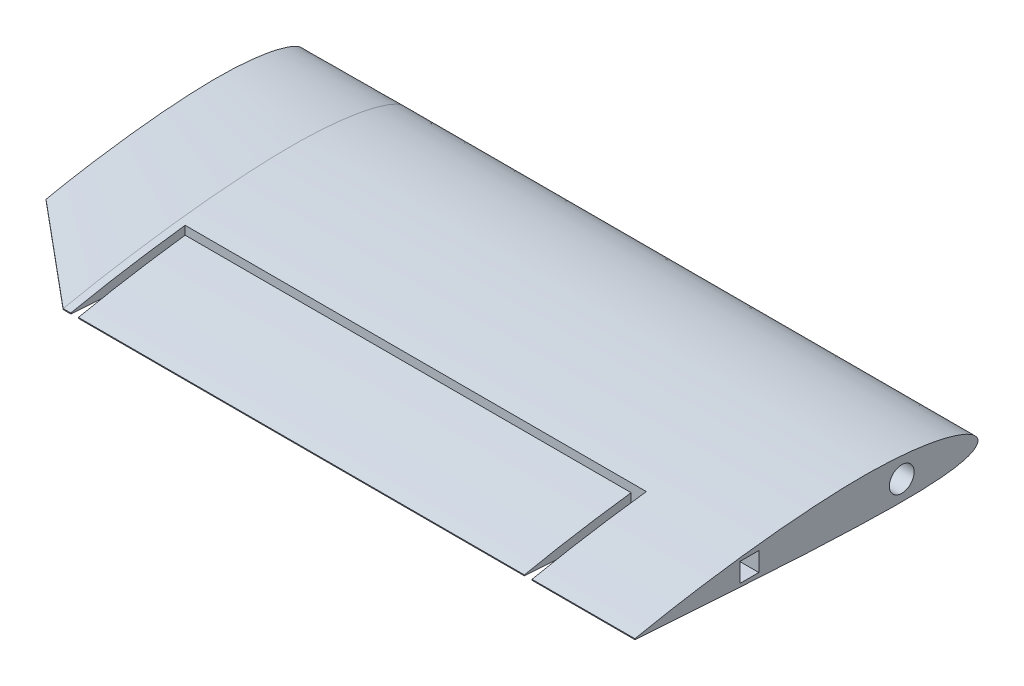
from build123d import *

# Parameters (mm, degrees)
EXTERIOR_DEPTH      = 90
BOSS_EXTRUDE1_DEPTH = 15
CUT_EXTRUDE1_DEPTH  = 187.882316063
BOSS_EXTRUDE2_DEPTH = 270
CUT_EXTRUDE3_DEPTH  = 3
SKETCH15_R          = 1.749999997
CUT_EXTRUDE4_DEPTH  = 4
CUT_EXTRUDE5_DEPTH  = 2.5
CUT_EXTRUDE6_DEPTH  = 287.184732781
BOSS_EXTRUDE3_DEPTH = 25
SKETCH20_R          = 3.25
CUT_EXTRUDE7_DEPTH  = 80
CUT_EXTRUDE8_DEPTH  = 195.44544138
CUT_EXTRUDE9_DEPTH  = 413.932233564
SKETCH26_W          = 35
SKETCH26_H          = 35
CUT_EXTRUDE11_DEPTH = 24
SKETCH27_R          = 3.25
BOSS_EXTRUDE4_DEPTH = 25
SKETCH29_W          = 5
SKETCH29_H          = 5
CUT_EXTRUDE12_DEPTH = 10


with BuildPart() as part:
    # Sketch4 → Exterior (new body)
    with BuildSketch(Plane.XY):
        with BuildLine():
            Line((-30.310889132, 17.5), (30.310889132, 17.5))
            ThreePointArc((30.310889132, 17.5), (0, 35), (-30.310889132, 17.5))
        make_face()
    extrude(amount=EXTERIOR_DEPTH)

    # Sketch5 → Boss-Extrude1 (add)
    with BuildSketch(Plane(origin=(0, 0, 0), x_dir=(-1, 0, 0), z_dir=(0, 0, -1))):
        with BuildLine():
            Line((23.12466216, 17.5), (-23.12466216, 17.5))
            ThreePointArc((-23.12466216, 17.5), (0, 29), (23.12466216, 17.5))
        make_face()
    extrude(amount=BOSS_EXTRUDE1_DEPTH)

    # Sketch8 → Loft9 section 0
    with BuildSketch(Plane(origin=(80, 0, 0), x_dir=(0, 0, -1), z_dir=(1, 0, 0))):
        with BuildLine():
            Line((-90, 21.432366243), (-90, 21.198382159))
            add(Edge.make_bspline(
                [(-90, 21.432366243), (-88.500933926, 21.739545374), (-85.506738957, 22.353096852), (-79.513207025, 23.476900974), (-72.017254902, 24.722076868), (-63.016159498, 26.010803551), (-54.016548901, 27.085553985), (-45.013036623, 27.872502339), (-36.011574753, 28.405421098), (-28.501382509, 28.495628322), (-22.499148056, 28.247142418), (-17.99379134, 27.883038763), (-13.482746661, 27.306456938), (-9.728435841, 26.596441021), (-6.735425578, 25.793161808), (-4.466301103, 25.062862179), (-2.543789771, 24.211953422), (-0.885448876, 23.18032068), (0.560680661, 21.396258105), (-0.941462624, 19.828099306), (-2.568784612, 19.112875936), (-4.482837902, 18.569587924), (-6.74449179, 18.180048952), (-9.749480667, 17.847620831), (-13.500436316, 17.59175521), (-18.004367236, 17.489171146), (-22.5050837, 17.50346658), (-28.505231535, 17.63591039), (-36.00611648, 17.874235378), (-45.006065516, 18.288993082), (-54.003404842, 18.828075055), (-63.002270201, 19.388407607), (-72.00267421, 19.955585158), (-79.500543105, 20.477953196), (-85.500687681, 20.880865225), (-88.500160566, 21.092538335), (-90, 21.198382159)],
                knots=[0, 0, 0, 0, 0.02501249, 0.049959286, 0.099672925, 0.14920632, 0.198581097, 0.24780517, 0.296916575, 0.345952722, 0.370491626, 0.395091204, 0.419814796, 0.444798575, 0.457489819, 0.470406405, 0.483879409, 0.49126412, 0.503458853, 0.513609129, 0.520450991, 0.533235388, 0.545691039, 0.558031884, 0.582609167, 0.607134742, 0.63165208, 0.656174272, 0.705233949, 0.754320379, 0.803437364, 0.852566096, 0.901700994, 0.950848809, 0.975422717, 1, 1, 1, 1], degree=3))
        make_face()
    # Sketch9 → Loft9 section 1
    with BuildSketch(Plane(origin=(-80, 0, 0), x_dir=(0, 0, -1), z_dir=(1, 0, 0))):
        with BuildLine():
            Line((-90, 21.432366243), (-90, 21.198382159))
            add(Edge.make_bspline(
                [(-90, 21.432366243), (-88.500933926, 21.739545374), (-85.506738957, 22.353096852), (-79.513207025, 23.476900974), (-72.017254902, 24.722076868), (-63.016159498, 26.010803551), (-54.016548901, 27.085553985), (-45.013036623, 27.872502339), (-36.011574753, 28.405421098), (-28.501382509, 28.495628322), (-22.499148056, 28.247142418), (-17.99379134, 27.883038763), (-13.482746661, 27.306456938), (-9.728435841, 26.596441021), (-6.735425578, 25.793161808), (-4.466301103, 25.062862179), (-2.543789771, 24.211953422), (-0.885448876, 23.18032068), (0.560680661, 21.396258105), (-0.941462624, 19.828099306), (-2.568784612, 19.112875936), (-4.482837902, 18.569587924), (-6.74449179, 18.180048952), (-9.749480667, 17.847620831), (-13.500436316, 17.59175521), (-18.004367236, 17.489171146), (-22.5050837, 17.50346658), (-28.505231535, 17.63591039), (-36.00611648, 17.874235378), (-45.006065516, 18.288993082), (-54.003404842, 18.828075055), (-63.002270201, 19.388407607), (-72.00267421, 19.955585158), (-79.500543105, 20.477953196), (-85.500687681, 20.880865225), (-88.500160566, 21.092538335), (-90, 21.198382159)],
                knots=[0, 0, 0, 0, 0.02501249, 0.049959286, 0.099672925, 0.14920632, 0.198581097, 0.24780517, 0.296916575, 0.345952722, 0.370491626, 0.395091204, 0.419814796, 0.444798575, 0.457489819, 0.470406405, 0.483879409, 0.49126412, 0.503458853, 0.513609129, 0.520450991, 0.533235388, 0.545691039, 0.558031884, 0.582609167, 0.607134742, 0.63165208, 0.656174272, 0.705233949, 0.754320379, 0.803437364, 0.852566096, 0.901700994, 0.950848809, 0.975422717, 1, 1, 1, 1], degree=3))
        make_face()
    loft()

    # Sketch12 → Cut-Extrude1 (cut, through all)
    with BuildSketch(Plane(origin=(80, 0, 0), x_dir=(0, 0, -1), z_dir=(1, 0, 0))):
        with BuildLine():
            add(Edge.make_bspline(
                [(-90, 21.432366243), (-88.517970234, 21.737980939), (-85.557803137, 22.348407657), (-79.632256681, 23.467116444), (-72.221134443, 24.707701375), (-63.321647609, 25.993209562), (-54.423365173, 27.067117347), (-45.520869444, 27.856425887), (-37.923196081, 28.315745298), (-33.290343793, 28.425153226), (-31.628845216, 28.436220013)],
                knots=[0, 0, 0, 0, 0.02501249, 0.049959286, 0.099672925, 0.14920632, 0.198581097, 0.24780517, 0.296916575, 0.324376959, 0.324376959, 0.324376959, 0.324376959], degree=3))
            add(Edge.make_bspline(
                [(-90, 21.432366243), (-88.500933926, 21.739545374), (-85.506738957, 22.353096852), (-79.513207025, 23.476900974), (-72.017254902, 24.722076868), (-63.016159498, 26.010803551), (-54.016548901, 27.085553985), (-45.013036623, 27.872502339), (-37.550589404, 28.314305923), (-33.087456779, 28.421897917), (-31.628845216, 28.436220013)],
                knots=[0, 0, 0, 0, 0.02501249, 0.049959286, 0.099672925, 0.14920632, 0.198581097, 0.24780517, 0.296916575, 0.320756027, 0.320756027, 0.320756027, 0.320756027], degree=3))
        make_face()
        with BuildLine():
            Line((-97.240851338, 26.906548897), (-90, 21.432366243))
            add(Edge.make_bspline(
                [(-90, 21.432366243), (-88.517970234, 21.737980939), (-85.557803137, 22.348407657), (-79.632256681, 23.467116444), (-72.221134443, 24.707701375), (-63.321647609, 25.993209562), (-54.423365173, 27.067117347), (-45.520869444, 27.856425887), (-37.923196081, 28.315745298), (-33.290343793, 28.425153226), (-31.628845216, 28.436220013)],
                knots=[0, 0, 0, 0, 0.02501249, 0.049959286, 0.099672925, 0.14920632, 0.198581097, 0.24780517, 0.296916575, 0.324376959, 0.324376959, 0.324376959, 0.324376959], degree=3))
            Line((-31.628845216, 28.436220013), (-0.011306323, 30.013384743))
            Line((-0.011306323, 30.013384743), (6.418630162, 38.518437853))
            Line((6.418630162, 38.518437853), (-30.113825381, 44.023328414))
            Line((-30.113825381, 44.023328414), (-90.292288108, 42.772216923))
            Line((-90.292288108, 42.772216923), (-97.240851338, 26.906548897))
        make_face()
    extrude(amount=-CUT_EXTRUDE1_DEPTH, mode=Mode.SUBTRACT)

    # Sketch17 → Boss-Extrude2 (add)
    with BuildSketch(Plane.ZY.offset(80)):
        with BuildLine():
            Line((90, 21.432366243), (90, 21.198382159))
            add(Edge.make_bspline(
                [(90, 21.432366243), (88.500933926, 21.739545374), (85.506738957, 22.353096852), (79.513207025, 23.476900974), (72.017254902, 24.722076868), (63.016159498, 26.010803551), (54.016548901, 27.085553985), (45.013036623, 27.872502339), (36.011574753, 28.405421098), (28.501382509, 28.495628322), (22.499148056, 28.247142418), (17.99379134, 27.883038763), (13.482746661, 27.306456938), (9.728435841, 26.596441021), (6.735425578, 25.793161808), (4.466301103, 25.062862179), (2.543789771, 24.211953422), (0.885448876, 23.18032068), (-0.560680661, 21.396258105), (0.941462624, 19.828099306), (2.568784612, 19.112875936), (4.482837902, 18.569587924), (6.74449179, 18.180048952), (9.749480667, 17.847620831), (13.500436316, 17.59175521), (18.004367236, 17.489171146), (22.5050837, 17.50346658), (28.505231535, 17.63591039), (36.00611648, 17.874235378), (45.006065516, 18.288993082), (54.003404842, 18.828075055), (63.002270201, 19.388407607), (72.00267421, 19.955585158), (79.500543105, 20.477953196), (85.500687681, 20.880865225), (88.500160566, 21.092538335), (90, 21.198382159)],
                knots=[0, 0, 0, 0, 0.02501249, 0.049959286, 0.099672925, 0.14920632, 0.198581097, 0.24780517, 0.296916575, 0.345952722, 0.370491626, 0.395091204, 0.419814796, 0.444798575, 0.457489819, 0.470406405, 0.483879409, 0.49126412, 0.503458853, 0.513609129, 0.520450991, 0.533235388, 0.545691039, 0.558031884, 0.582609167, 0.607134742, 0.63165208, 0.656174272, 0.705233949, 0.754320379, 0.803437364, 0.852566096, 0.901700994, 0.950848809, 0.975422717, 1, 1, 1, 1], degree=3))
        make_face()
    extrude(amount=BOSS_EXTRUDE2_DEPTH)

    # Sketch14 → Cut-Extrude3 (cut)
    with BuildSketch(Plane(origin=(0, 30, 0), x_dir=(1, 0, 0), z_dir=(0, 1, 0))):
        with BuildLine():
            Line((-65, -33.999999003), (-95, -33.999999003))
            ThreePointArc((-95, -33.999999003), (-101, -39.999999003), (-95, -45.999999003))
            Line((-95, -45.999999003), (-65, -45.999999003))
            ThreePointArc((-65, -45.999999003), (-59, -39.999999003), (-65, -33.999999003))
        make_face()
    cut_extrude3 = extrude(amount=-CUT_EXTRUDE3_DEPTH, mode=Mode.SUBTRACT)

    # Sketch15 → Cut-Extrude4 (cut)
    with BuildSketch(Plane(origin=(0, 27, 0), x_dir=(1, 0, 0), z_dir=(0, 1, 0))):
        with Locations((-65, -39.999999003)):
            Circle(SKETCH15_R)
        with Locations((-95, -39.999999003)):
            Circle(SKETCH15_R)
    cut_extrude4 = extrude(amount=-CUT_EXTRUDE4_DEPTH, mode=Mode.SUBTRACT)

    # Sketch16 → Cut-Extrude5 (cut)
    with BuildSketch(Plane(origin=(0, 23.5, 0), x_dir=(1, 0, 0), z_dir=(0, 1, 0))):
        Polygon((-67.165063509, -43.749999003), (-62.834936491, -43.749999003), (-60.669872981, -39.999999003), (-62.834936491, -36.249999003), (-67.165063509, -36.249999003), (-69.330127019, -39.999999003), align=None)
        Polygon((-90.669872981, -39.999999003), (-92.834936491, -43.749999003), (-97.165063509, -43.749999003), (-99.330127019, -39.999999003), (-97.165063509, -36.249999003), (-92.834936491, -36.249999003), align=None)
    cut_extrude5 = extrude(amount=CUT_EXTRUDE5_DEPTH, mode=Mode.SUBTRACT)

    # Mirror1: Cut-Extrude3, Cut-Extrude4, Cut-Extrude5 across plane
    add(cut_extrude3.mirror(Plane(origin=(0, 0, 0), x_dir=(0, 0, 1), z_dir=(1, 0, 0))), mode=Mode.SUBTRACT)
    add(cut_extrude4.mirror(Plane(origin=(0, 0, 0), x_dir=(0, 0, 1), z_dir=(1, 0, 0))), mode=Mode.SUBTRACT)
    add(cut_extrude5.mirror(Plane(origin=(0, 0, 0), x_dir=(0, 0, 1), z_dir=(1, 0, 0))), mode=Mode.SUBTRACT)

    # Sketch18 → Cut-Extrude6 (cut, through all)
    with BuildSketch(Plane(origin=(-80, 0, 0), x_dir=(0, 0, -1), z_dir=(1, 0, 0))):
        Polygon((-99.866971184, 5.715372229), (-104.390100049, 63.325750406), (31.898914441, 60.82612656), (39.278756274, -3.211855795), align=None)
    extrude(amount=CUT_EXTRUDE6_DEPTH, mode=Mode.SUBTRACT)

    # Sketch19 → Boss-Extrude3 (add)
    with BuildSketch(Plane.ZY.offset(350)):
        with BuildLine():
            Line((90, 21.432366243), (90, 21.198382159))
            add(Edge.make_bspline(
                [(90, 21.432366243), (88.500933926, 21.739545374), (85.506738957, 22.353096852), (79.513207025, 23.476900974), (72.017254902, 24.722076868), (63.016159498, 26.010803551), (54.016548901, 27.085553985), (45.013036623, 27.872502339), (36.011574753, 28.405421098), (28.501382509, 28.495628322), (22.499148056, 28.247142418), (17.99379134, 27.883038763), (13.482746661, 27.306456938), (9.728435841, 26.596441021), (6.735425578, 25.793161808), (4.466301103, 25.062862179), (2.543789771, 24.211953422), (0.885448876, 23.18032068), (-0.560680661, 21.396258105), (0.941462624, 19.828099306), (2.568784612, 19.112875936), (4.482837902, 18.569587924), (6.74449179, 18.180048952), (9.749480667, 17.847620831), (13.500436316, 17.59175521), (18.004367236, 17.489171146), (22.5050837, 17.50346658), (28.505231535, 17.63591039), (36.00611648, 17.874235378), (45.006065516, 18.288993082), (54.003404842, 18.828075055), (63.002270201, 19.388407607), (72.00267421, 19.955585158), (79.500543105, 20.477953196), (85.500687681, 20.880865225), (88.500160566, 21.092538335), (90, 21.198382159)],
                knots=[0, 0, 0, 0, 0.02501249, 0.049959286, 0.099672925, 0.14920632, 0.198581097, 0.24780517, 0.296916575, 0.345952722, 0.370491626, 0.395091204, 0.419814796, 0.444798575, 0.457489819, 0.470406405, 0.483879409, 0.49126412, 0.503458853, 0.513609129, 0.520450991, 0.533235388, 0.545691039, 0.558031884, 0.582609167, 0.607134742, 0.63165208, 0.656174272, 0.705233949, 0.754320379, 0.803437364, 0.852566096, 0.901700994, 0.950848809, 0.975422717, 1, 1, 1, 1], degree=3))
        make_face()
    extrude(amount=BOSS_EXTRUDE3_DEPTH)

    # Sketch20 → Cut-Extrude7 (cut)
    with BuildSketch(Plane(origin=(-250, 0, 0), x_dir=(0, 0, -1), z_dir=(1, 0, 0))):
        with Locations((-20, 22.719194586)):
            Circle(SKETCH20_R)
    extrude(amount=-CUT_EXTRUDE7_DEPTH, mode=Mode.SUBTRACT)

    # Sketch21 → section 1 of loft10
    with BuildSketch(Plane(origin=(-402, 0, 0), x_dir=(0, 0, -1), z_dir=(1, 0, 0)), mode=Mode.PRIVATE) as loft10_s1:
        with BuildLine():
            Line((-67.49988337, 21.520211068), (-67.500114636, 21.34472331))
            add(Edge.make_bspline(
                [(-67.49988337, 21.520211068), (-66.375282157, 21.749113366), (-64.129033407, 22.206316768), (-59.632781517, 23.043244498), (-54.00959648, 23.969715934), (-47.257512897, 24.927362748), (-40.506754408, 25.724529122), (-33.753354121, 26.305840455), (-27.001742716, 26.696631949), (-21.369019156, 26.756864312), (-16.867596734, 26.564567708), (-13.488944938, 26.287037429), (-10.106237188, 25.850143177), (-7.29121073, 25.313921471), (-5.047250877, 24.708504871), (-3.346132292, 24.158538339), (-1.905092319, 23.518457704), (-0.662358456, 22.743095417), (0.420473478, 21.403621482), (-0.707681968, 20.228989116), (-1.928878253, 19.694180935), (-3.364952704, 19.28860745), (-5.061575187, 18.998689106), (-7.315641496, 18.752338524), (-10.12910624, 18.564147019), (-13.507149956, 18.491660707), (-16.882667312, 18.506830691), (-21.382639468, 18.612093812), (-27.00805785, 18.798250981), (-33.757597966, 19.118214105), (-40.505057923, 19.531417689), (-47.253641398, 19.960560689), (-54.003372093, 20.394838948), (-59.626247699, 20.794025054), (-64.125950085, 21.102138984), (-66.375341628, 21.263858166), (-67.500114636, 21.34472331)],
                knots=[0, 0, 0, 0, 0.02501249, 0.049959286, 0.099672925, 0.14920632, 0.198581097, 0.24780517, 0.296916575, 0.345952722, 0.370491626, 0.395091204, 0.419814796, 0.444798575, 0.457489819, 0.470406405, 0.483879409, 0.49126412, 0.503458853, 0.513609129, 0.520450991, 0.533235388, 0.545691039, 0.558031884, 0.582609167, 0.607134742, 0.63165208, 0.656174272, 0.705233949, 0.754320379, 0.803437364, 0.852566096, 0.901700994, 0.950848809, 0.975422717, 1, 1, 1, 1], degree=3))
        make_face()
    # loft from a face of the part (loft10)
    loft([part.faces().sort_by_distance((-375, 22.77082999, 38.12983496))[0], loft10_s1.sketch])

    # Sketch22 → Cut-Extrude8 (cut, through all)
    with BuildSketch(Plane(origin=(-250, 0, 0), x_dir=(0, 0, -1), z_dir=(1, 0, 0))):
        Polygon((-115.189774778, 57.109996335), (45.679371542, 59.96989227), (47.824293493, -10.812532111), (-124.722761227, -9.501746474), align=None)
    extrude(amount=CUT_EXTRUDE8_DEPTH, mode=Mode.SUBTRACT)

    # Sketch23 → Cut-Extrude9 (cut, through all)
    with BuildSketch(Plane(origin=(0, 0, 0), x_dir=(1, 0, 0), z_dir=(0, 1, 0))):
        Polygon((-373, -60), (-373, -90), (-371, -90), (-371, -62), (-254, -62), (-254, -90), (-252, -90), (-252, -60), align=None)
    extrude(amount=CUT_EXTRUDE9_DEPTH, mode=Mode.SUBTRACT)


with BuildPart() as cut_extrude9_piece_1:
    # of the separate pieces the step leaves, piece 1, a body of its own (cut_extrude9_pieces)
    add(part.part.solids().sort_by_distance((-250, 21.198382159, 90))[0])

    # Sketch26 → Cut-Extrude11 (cut)
    with BuildSketch(Plane(origin=(0, 0, 0), x_dir=(1, 0, 0), z_dir=(0, 1, 0))):
        with Locations((-312.5, -42.5)):
            Rectangle(SKETCH26_W, SKETCH26_H)
    extrude(amount=CUT_EXTRUDE11_DEPTH, mode=Mode.SUBTRACT)

    # Sketch27 → Boss-Extrude4 (add)
    with BuildSketch(Plane(origin=(-250, 0, 0), x_dir=(0, 0, -1), z_dir=(1, 0, 0))):
        with BuildLine():
            Line((-90, 21.198382159), (-90, 21.432366243))
            add(Edge.make_bspline(
                [(-90, 21.198382159), (-88.500160566, 21.092538335), (-85.500687681, 20.880865225), (-79.500543105, 20.477953196), (-72.00267421, 19.955585158), (-63.002270201, 19.388407607), (-54.003404842, 18.828075055), (-45.006065516, 18.288993082), (-36.00611648, 17.874235378), (-28.505231535, 17.63591039), (-22.5050837, 17.50346658), (-18.004367236, 17.489171146), (-13.500436316, 17.59175521), (-9.749480667, 17.847620831), (-6.74449179, 18.180048952), (-4.482837902, 18.569587924), (-2.568784612, 19.112875936), (-0.941462624, 19.828099306), (0.560680661, 21.396258105), (-0.885448876, 23.18032068), (-2.543789771, 24.211953422), (-4.466301103, 25.062862179), (-6.735425578, 25.793161808), (-9.728435841, 26.596441021), (-13.482746661, 27.306456938), (-17.99379134, 27.883038763), (-22.499148056, 28.247142418), (-28.501382509, 28.495628322), (-36.011574753, 28.405421098), (-45.013036623, 27.872502339), (-54.016548901, 27.085553985), (-63.016159498, 26.010803551), (-72.017254902, 24.722076868), (-79.513207025, 23.476900974), (-85.506738957, 22.353096852), (-88.500933926, 21.739545374), (-90, 21.432366243)],
                knots=[0, 0, 0, 0, 0.024577283, 0.049151191, 0.098299006, 0.147433904, 0.196562636, 0.245679621, 0.294766051, 0.343825728, 0.36834792, 0.392865258, 0.417390833, 0.441968116, 0.454308961, 0.466764612, 0.479549009, 0.486390871, 0.496541147, 0.50873588, 0.516120591, 0.529593595, 0.542510181, 0.555201425, 0.580185204, 0.604908796, 0.629508374, 0.654047278, 0.703083425, 0.75219483, 0.801418903, 0.85079368, 0.900327075, 0.950040714, 0.97498751, 1, 1, 1, 1], degree=3))
        make_face()
        with Locations((-20, 22.719194586)):
            Circle(SKETCH27_R, mode=Mode.SUBTRACT)
    extrude(amount=BOSS_EXTRUDE4_DEPTH)

    # Sketch29 → Cut-Extrude12 (cut)
    with BuildSketch(Plane(origin=(-225, 0, 0), x_dir=(0, 0, -1), z_dir=(1, 0, 0))):
        with Locations((-60, 22.719194586)):
            Rectangle(SKETCH29_W, SKETCH29_H)
    extrude(amount=-CUT_EXTRUDE12_DEPTH, mode=Mode.SUBTRACT)


with BuildPart() as cut_extrude9_piece_2:
    # of the separate pieces the step leaves, piece 2, a body of its own (cut_extrude9_pieces)
    add(part.part.solids().sort_by_distance((-254, 21.198382159, 90))[0])


solid = Compound([cut_extrude9_piece_1.part, cut_extrude9_piece_2.part])
